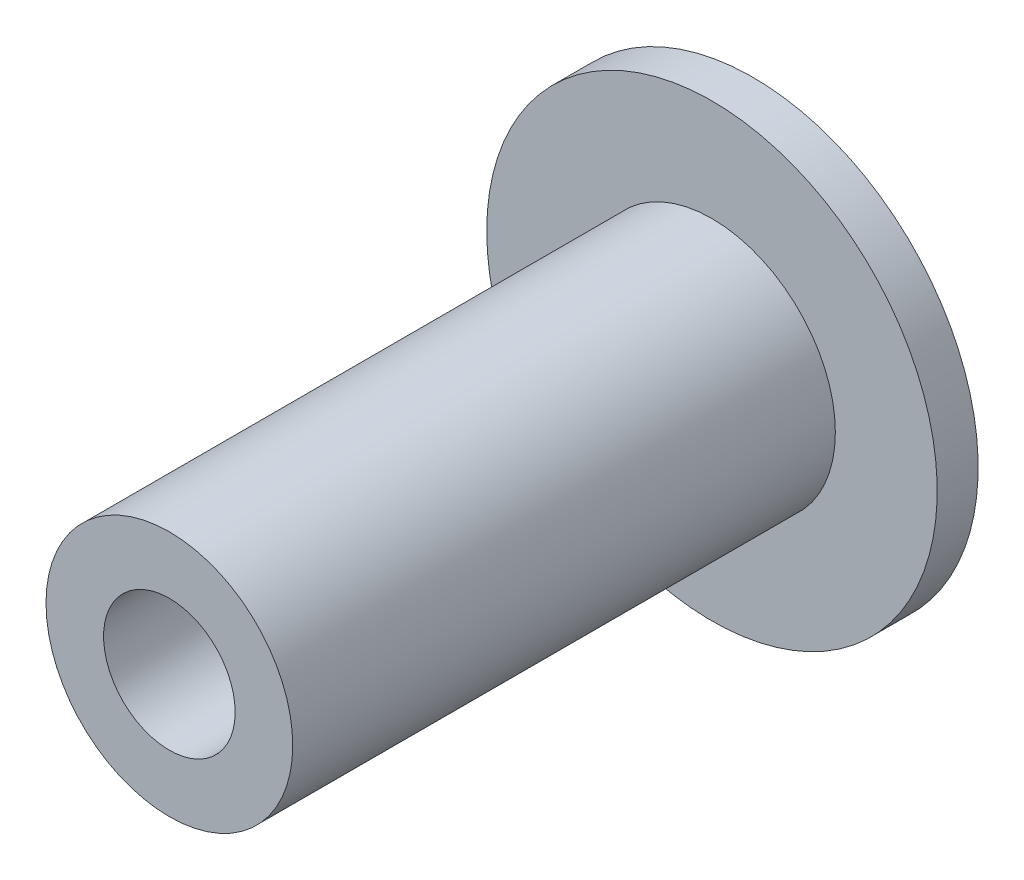
from build123d import *

# Parameters (mm, degrees)
SKETCH1_R           = 6.025
BOSS_EXTRUDE1_DEPTH = 10
SKETCH3_R           = 6.025
BOSS_EXTRUDE2_DEPTH = 16.5
SKETCH5_R           = 11
BOSS_EXTRUDE3_DEPTH = 2
SKETCH6_R           = 3.2131
CUT_EXTRUDE3_DEPTH  = 25.4


with BuildPart() as part:
    # Sketch1 → Boss-Extrude1 (new body)
    with BuildSketch(Plane.XY):
        Circle(SKETCH1_R)
    extrude(amount=BOSS_EXTRUDE1_DEPTH)

    # Sketch3 → Boss-Extrude2 (add)
    with BuildSketch(Plane.XY.offset(10)):
        Circle(SKETCH3_R)
    extrude(amount=BOSS_EXTRUDE2_DEPTH)

    # Sketch5 → Boss-Extrude3 (add)
    with BuildSketch(Plane(origin=(0, 0, 0), x_dir=(-1, 0, 0), z_dir=(0, 0, -1))):
        Circle(SKETCH5_R)
    extrude(amount=BOSS_EXTRUDE3_DEPTH)

    # Sketch6 → Cut-Extrude3 (cut)
    with BuildSketch(Plane.XY.offset(26.5)):
        Circle(SKETCH6_R)
    extrude(amount=-CUT_EXTRUDE3_DEPTH, mode=Mode.SUBTRACT)


solid = part.part
